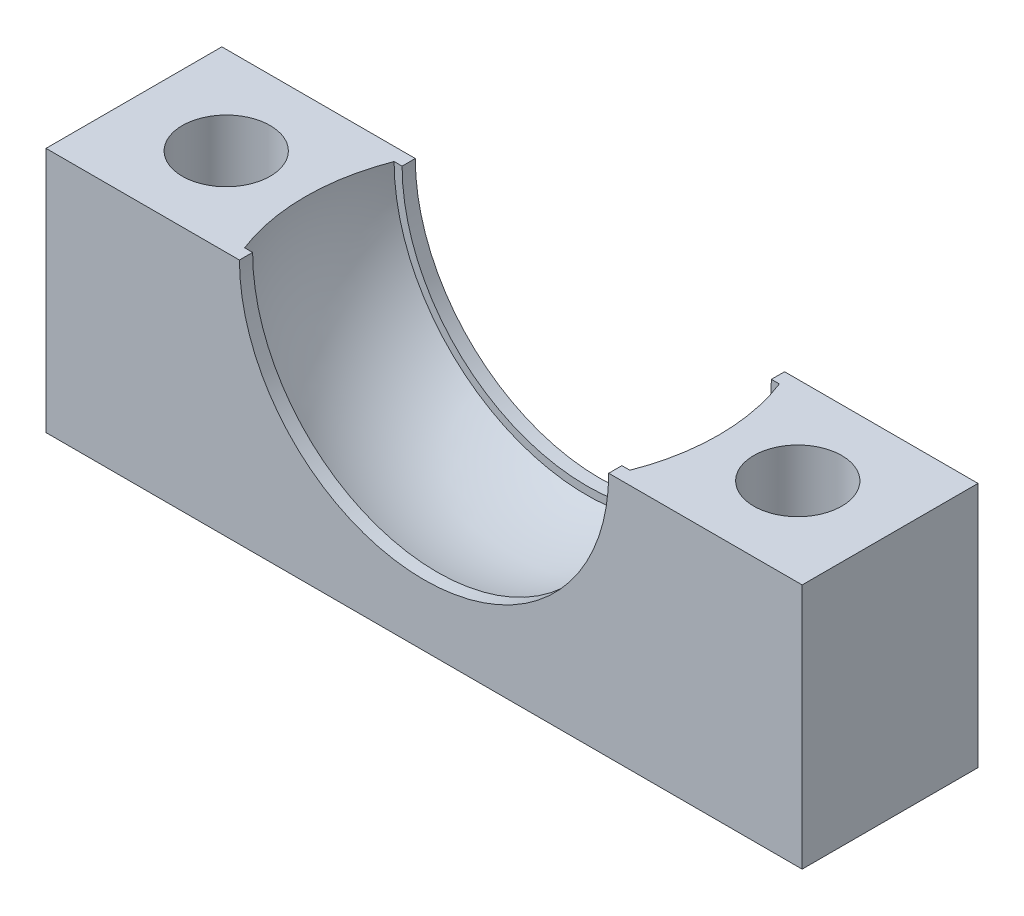
from build123d import *

# Parameters (mm, degrees)
SKETCH1_W           = 86
SKETCH1_H           = 28
BOSS_EXTRUDE1_DEPTH = 20
SKETCH2_R           = 5
CUT_EXTRUDE1_DEPTH  = 56.072679252


with BuildPart() as part:
    # Sketch1 → Boss-Extrude1 (new body)
    with BuildSketch(Plane.XY):
        with Locations((0, 14)):
            Rectangle(SKETCH1_W, SKETCH1_H)
    extrude(amount=BOSS_EXTRUDE1_DEPTH)

    # Sketch2 → Cut-Extrude1 (cut, through all)
    with BuildSketch(Plane(origin=(0, 0, 0), x_dir=(1, 0, 0), z_dir=(0, 1, 0))):
        with Locations((-32.5, -10)):
            Circle(SKETCH2_R)
        with Locations((32.5, -10)):
            Circle(SKETCH2_R)
    extrude(amount=CUT_EXTRUDE1_DEPTH, mode=Mode.SUBTRACT)

    # Sketch4 → Cut-Revolve1 (revolve, cut)
    with BuildSketch(Plane(origin=(0, 28, 0), x_dir=(-1, 0, 0), z_dir=(0, 1, 0))):
        with BuildLine():
            Line((0, 0), (0, 20))
            Line((0, 20), (21, 20))
            Line((21, 20), (21, 18.5))
            Line((21, 18.5), (21.9089023, 18.5))
            ThreePointArc((21.9089023, 18.5), (23.5, 10), (21.9089023, 1.5))
            Line((21.9089023, 1.5), (21, 1.5))
            Line((21, 1.5), (21, 0))
            Line((21, 0), (0, 0))
        make_face()
    revolve(axis=Axis((0, 28, 0), (0, 0, 1)), mode=Mode.SUBTRACT)


solid = part.part
